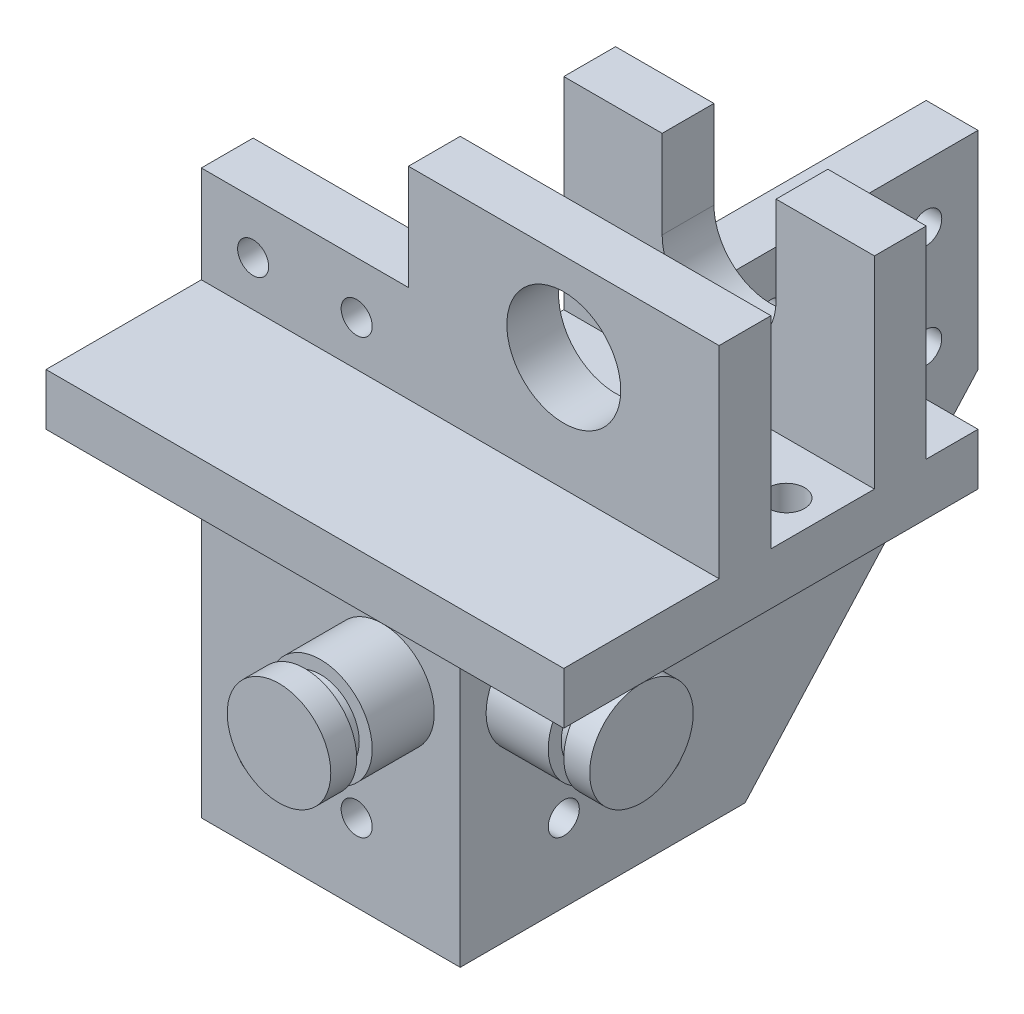
from build123d import *

# Parameters (mm, degrees)
BOSS_EXTRUDE1_DEPTH = 10
SKETCH2_W           = 40
SKETCH2_H           = 10
BOSS_EXTRUDE2_DEPTH = 18.71
BOSS_EXTRUDE3_DEPTH = 80
SKETCH5_W           = 10
SKETCH5_H           = 90
BOSS_EXTRUDE4_DEPTH = 50
CUT_EXTRUDE1_DEPTH  = 10
SKETCH7_W           = 60
SKETCH7_H           = 10
BOSS_EXTRUDE5_DEPTH = 39
SKETCH8_R           = 3.5
CUT_EXTRUDE2_DEPTH  = 10
CUT_EXTRUDE3_DEPTH  = 10
SKETCH10_R          = 11
SKETCH10_R_2        = 3
CUT_EXTRUDE4_DEPTH  = 10
SKETCH11_R          = 3
CUT_EXTRUDE5_DEPTH  = 10
CUT_EXTRUDE6_START  = -10
CUT_EXTRUDE6_DEPTH  = 10
SKETCH13_R          = 10
BOSS_EXTRUDE6_DEPTH = 20
CUT_EXTRUDE7_START  = -8
SKETCH14_R          = 10
SKETCH14_R_2        = 7.5
CUT_EXTRUDE7_DEPTH  = 3
SKETCH15_R          = 10
BOSS_EXTRUDE7_DEPTH = 20
CUT_EXTRUDE8_START  = -8
SKETCH16_R          = 10
SKETCH16_R_2        = 7.5
CUT_EXTRUDE8_DEPTH  = 3


with BuildPart() as part:
    # Sketch1 → Boss-Extrude1 (new body)
    with BuildSketch(Plane(origin=(0, 0, 0), x_dir=(1, 0, 0), z_dir=(0, 1, 0))):
        Polygon((0, 0), (100, 0), (100, 80), (40, 80), (40, 40), (0, 40), align=None)
    extrude(amount=BOSS_EXTRUDE1_DEPTH)

    # Sketch2 → Boss-Extrude2 (add)
    with BuildSketch(Plane(origin=(0, 10, 0), x_dir=(1, 0, 0), z_dir=(0, 1, 0))):
        with Locations((20, 35)):
            Rectangle(SKETCH2_W, SKETCH2_H)
    extrude(amount=BOSS_EXTRUDE2_DEPTH)

    # Sketch3 → Boss-Extrude3 (add)
    with BuildSketch(Plane.XZ):
        Polygon((0, -30), (50, -30), (50, -80), (40, -80), (40, -40), (0, -40), align=None)
    extrude(amount=BOSS_EXTRUDE3_DEPTH)

    # Sketch5 → Boss-Extrude4 (add)
    with BuildSketch(Plane(origin=(0, 0, -80), x_dir=(-1, 0, 0), z_dir=(0, 0, -1))):
        with Locations((-45, -35)):
            Rectangle(SKETCH5_W, SKETCH5_H)
    extrude(amount=BOSS_EXTRUDE4_DEPTH)

    # Sketch6 → Cut-Extrude1 (cut)
    with BuildSketch(Plane.ZY.offset(-40)):
        Polygon((-85, -80), (-130, -30), (-130, -80), align=None)
    extrude(amount=-CUT_EXTRUDE1_DEPTH, mode=Mode.SUBTRACT)

    # Sketch7 → Boss-Extrude5 (add)
    with BuildSketch(Plane(origin=(0, 10, 0), x_dir=(1, 0, 0), z_dir=(0, 1, 0))):
        with Locations((70, 65)):
            Rectangle(SKETCH7_W, SKETCH7_H)
        with Locations((70, 35)):
            Rectangle(SKETCH7_W, SKETCH7_H)
    extrude(amount=BOSS_EXTRUDE5_DEPTH)

    # Sketch8 → Cut-Extrude2 (cut)
    with BuildSketch(Plane(origin=(0, 10, 0), x_dir=(1, 0, 0), z_dir=(0, 1, 0))):
        with Locations((47, 50)):
            Circle(SKETCH8_R)
        with Locations((93, 50)):
            Circle(SKETCH8_R)
    extrude(amount=-CUT_EXTRUDE2_DEPTH, mode=Mode.SUBTRACT)

    # Sketch9 → Cut-Extrude3 (cut)
    with BuildSketch(Plane(origin=(50, 0, 0), x_dir=(0, 0, -1), z_dir=(1, 0, 0))):
        Polygon((50, 0), (57, 0), (57, -6), (43, -6), (43, 0), align=None)
    extrude(amount=-CUT_EXTRUDE3_DEPTH, mode=Mode.SUBTRACT)

    # Sketch10 → Cut-Extrude4 (cut)
    with BuildSketch(Plane.XY.offset(-30)):
        with Locations((70, 32)):
            Circle(SKETCH10_R)
        with Locations((30, 18.71)):
            Circle(SKETCH10_R_2)
        with Locations((10, 18.71)):
            Circle(SKETCH10_R_2)
        with Locations((30, -15)):
            Circle(SKETCH10_R_2)
        with Locations((10, -15)):
            Circle(SKETCH10_R_2)
        with Locations((30, -65)):
            Circle(SKETCH10_R_2)
        with Locations((10, -65)):
            Circle(SKETCH10_R_2)
    extrude(amount=-CUT_EXTRUDE4_DEPTH, mode=Mode.SUBTRACT)

    # Sketch11 → Cut-Extrude5 (cut)
    with BuildSketch(Plane(origin=(50, 0, 0), x_dir=(0, 0, -1), z_dir=(1, 0, 0))):
        with Locations((50, -15)):
            Circle(SKETCH11_R)
        with Locations((70, -15)):
            Circle(SKETCH11_R)
        with Locations((70, -65)):
            Circle(SKETCH11_R)
        with Locations((50, -65)):
            Circle(SKETCH11_R)
        with Locations((90, -1.3)):
            Circle(SKETCH11_R)
        with Locations((120, -1.3)):
            Circle(SKETCH11_R)
        with Locations((90, -21.3)):
            Circle(SKETCH11_R)
        with Locations((120, -21.3)):
            Circle(SKETCH11_R)
    extrude(amount=-CUT_EXTRUDE5_DEPTH, mode=Mode.SUBTRACT)

    # Sketch12 → Cut-Extrude6 (cut)
    with BuildSketch(Plane(origin=(0, 0, -70), x_dir=(-1, 0, 0), z_dir=(0, 0, -1)).offset(CUT_EXTRUDE6_START)):
        with BuildLine():
            Line((-70, 49), (-59, 49))
            Line((-59, 49), (-59, 32))
            ThreePointArc((-59, 32), (-70, 21), (-81, 32))
            Line((-81, 32), (-81, 49))
            Line((-81, 49), (-70, 49))
        make_face()
    extrude(amount=CUT_EXTRUDE6_DEPTH, mode=Mode.SUBTRACT)

    # Sketch13 → Boss-Extrude6 (add)
    with BuildSketch(Plane(origin=(50, 0, 0), x_dir=(0, 0, -1), z_dir=(1, 0, 0))):
        with Locations((45, -40)):
            Circle(SKETCH13_R)
    extrude(amount=BOSS_EXTRUDE6_DEPTH)

    # Sketch14 → Cut-Extrude7 (cut)
    with BuildSketch(Plane(origin=(70, 0, 0), x_dir=(0, 0, -1), z_dir=(1, 0, 0)).offset(CUT_EXTRUDE7_START)):
        with Locations((45, -40)):
            Circle(SKETCH14_R)
        with Locations((45, -40)):
            Circle(SKETCH14_R_2, mode=Mode.SUBTRACT)
    extrude(amount=CUT_EXTRUDE7_DEPTH, mode=Mode.SUBTRACT)

    # Sketch15 → Boss-Extrude7 (add)
    with BuildSketch(Plane.XY.offset(-30)):
        with Locations((35, -40)):
            Circle(SKETCH15_R)
    extrude(amount=BOSS_EXTRUDE7_DEPTH)

    # Sketch16 → Cut-Extrude8 (cut)
    with BuildSketch(Plane.XY.offset(-10).offset(CUT_EXTRUDE8_START)):
        with Locations((35, -40)):
            Circle(SKETCH16_R)
        with Locations((35, -40)):
            Circle(SKETCH16_R_2, mode=Mode.SUBTRACT)
    extrude(amount=CUT_EXTRUDE8_DEPTH, mode=Mode.SUBTRACT)


solid = part.part
